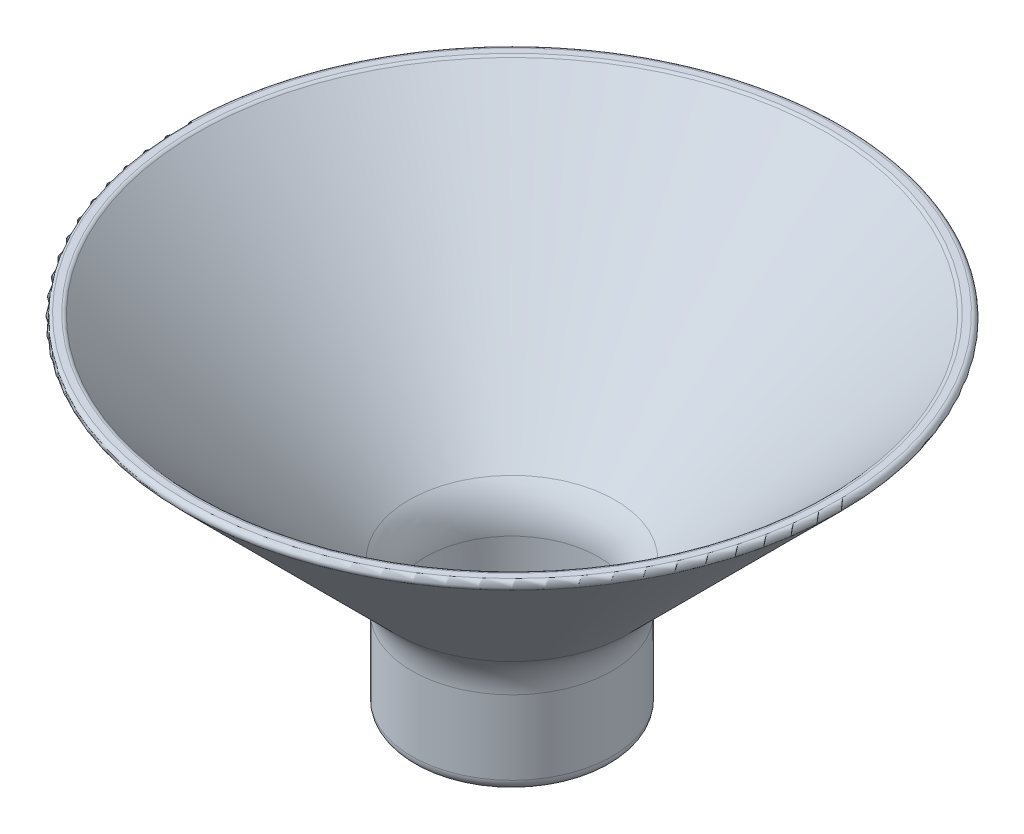
from build123d import *

# Parameters (mm, degrees)
FILLET1_R = 5
FILLET2_R = 0.4
FILLET3_R = 1


with BuildPart() as part:
    # Sketch1 → Revolve1 (revolve)
    with BuildSketch(Plane.XY):
        Polygon((7.5, 2.598076211), (7.5, 10), (27.5, 30), (29.197056275, 30), (8.7, 9.502943725), (8.7, 2.27653718), (8.7, 0), (6, 0), align=None)
    revolve(axis=Axis((0, 0, 0), (0, 1, 0)))

    # Fillet1
    fillet1_edges = [part.edges().sort_by_distance(p)[0] for p in [
        (-8.7, 9.502943725, 0),
        (-7.5, 10, 0),
    ]]
    fillet(fillet1_edges, radius=FILLET1_R)

    # Fillet2
    fillet2_edges = [part.edges().sort_by_distance(p)[0] for p in [
        (-27.5, 30, 0),
        (-29.197056275, 30, 0),
    ]]
    fillet(fillet2_edges, radius=FILLET2_R)

    # Fillet3
    fillet3_edges = [part.edges().sort_by_distance(p)[0] for p in [
        (-8.7, 0, 0),
    ]]
    fillet(fillet3_edges, radius=FILLET3_R)


solid = part.part
